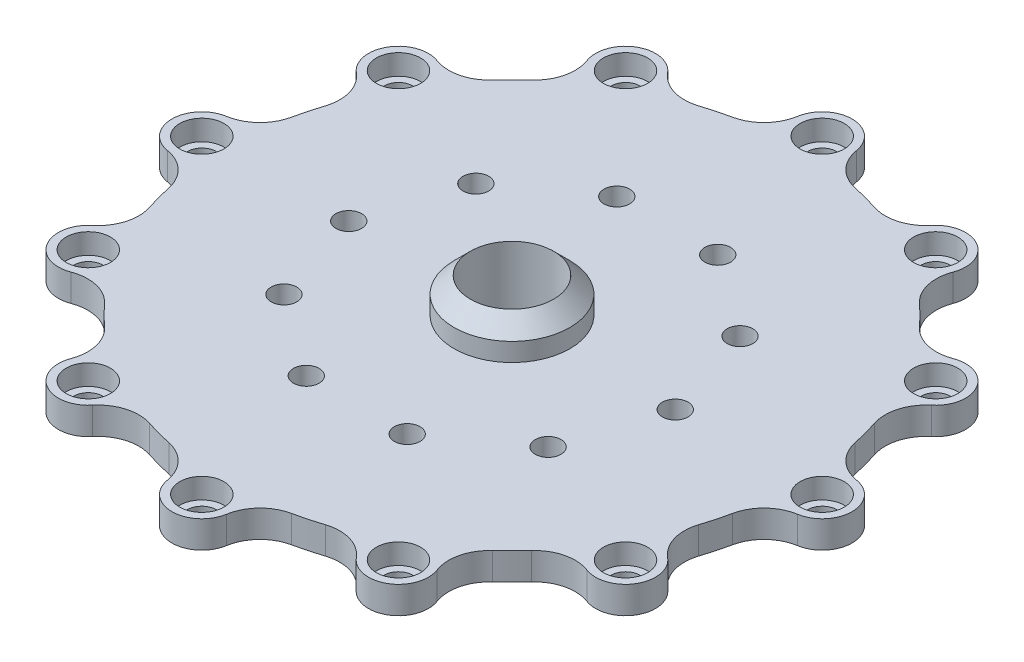
from build123d import *

# Parameters (mm, degrees)
CHAMFER1_SIZE                                    = 3.81
HOLE2_D                                          = 6
CIRPATTERN2_COUNT                                = 10
CBORE_FOR_1_4_SOCKET_SHOULDER_SCREW1_D           = 6.7564
CBORE_FOR_1_4_SOCKET_SHOULDER_SCREW1_CBORE_D     = 10.31748
CBORE_FOR_1_4_SOCKET_SHOULDER_SCREW1_CBORE_DEPTH = 4.7752
CIRPATTERN4_COUNT                                = 12
CUT_EXTRUDE3_REACH                               = 116.288
CIRPATTERN5_COUNT                                = 12


with BuildPart() as part:
    # Sketch1 → Revolve1 (revolve)
    with BuildSketch(Plane.XY):
        Polygon((79.375, 10.68578), (79.375, 17.03578), (13.52042, 17.03578), (13.52042, 25.13076), (9.71042, 25.13076), (9.71042, 0), (14.14526, -4.43484), (19.22526, -4.43484), (19.22526, 10.68578), align=None)
    revolve(axis=Axis((0, 0, 0), (0, 1, 0)))

    # Chamfer1
    chamfer1_edges = [part.edges().sort_by_distance(p)[0] for p in [
        (-13.52042, 25.13076, 0),
    ]]
    chamfer(chamfer1_edges, length=CHAMFER1_SIZE - 0.0001)  # a hair under: the kernel refuses the full size

    # Hole2 (through all)
    with Locations(Plane(origin=(0, 17.03578, 0), x_dir=(1, 0, 0), z_dir=(0, 1, 0))):
        with Locations((38.1, 0)):
            hole2 = Hole(HOLE2_D / 2)

    # CirPattern2: Hole2 ×10 about axis
    cirpattern2_axis = Axis((0, 0, 0), (0, 1, 0))
    for i in range(1, CIRPATTERN2_COUNT):
        add(hole2.rotate(cirpattern2_axis, i * 360 / CIRPATTERN2_COUNT), mode=Mode.SUBTRACT)

    # CBORE for 1/4 Socket Shoulder Screw1 (through all)
    with Locations(Plane(origin=(0, 17.03578, 0), x_dir=(1, 0, 0), z_dir=(0, 1, 0))):
        with Locations((72.39, 0)):
            cbore_for_1_4_socket_shoulder_screw1 = CounterBoreHole(CBORE_FOR_1_4_SOCKET_SHOULDER_SCREW1_D / 2, CBORE_FOR_1_4_SOCKET_SHOULDER_SCREW1_CBORE_D / 2, CBORE_FOR_1_4_SOCKET_SHOULDER_SCREW1_CBORE_DEPTH)

    # CirPattern4: CBORE for 1/4 Socket Shoulder Screw1 ×12 about axis
    cirpattern4_axis = Axis((0, 0, 0), (0, 1, 0))
    for i in range(1, CIRPATTERN4_COUNT):
        add(cbore_for_1_4_socket_shoulder_screw1.rotate(cirpattern4_axis, i * 360 / CIRPATTERN4_COUNT), mode=Mode.SUBTRACT)

    # Sketch17 → Cut-Extrude3 (cut, up to next)
    with BuildSketch(Plane(origin=(0, 17.03578, 0), x_dir=(1, 0, 0), z_dir=(0, 1, 0)), mode=Mode.PRIVATE) as cut_extrude3_sk1:
        with BuildLine():
            ThreePointArc((79.375, 0), (77.717548697, 4.517460557), (73.531778846, 6.891049707))
            ThreePointArc((73.531778846, 6.891049707), (68.521982999, 9.388428721), (65.780227273, 14.268770092))
            ThreePointArc((65.780227273, 14.268770092), (65.016467368, 17.421109926), (64.101732931, 20.532996256))
            ThreePointArc((64.101732931, 20.532996256), (64.035992356, 26.130373726), (67.12591332, 30.798065318))
            ThreePointArc((67.12591332, 30.798065318), (69.56410177, 34.946538746), (68.740766425, 39.6875))
            ThreePointArc((68.740766425, 39.6875), (76.670362462, 20.543761705), (79.375, 0))
        make_face()
    cut_extrude3_tool1 = extrude(cut_extrude3_sk1.sketch, amount=-CUT_EXTRUDE3_REACH, mode=Mode.PRIVATE) & part.part
    cut_extrude3 = cut_extrude3_tool1.solids().sort_by_distance((71.346501, 17.03578, -19.117237))[0]
    add(cut_extrude3, mode=Mode.SUBTRACT)

    # CirPattern5: Cut-Extrude3 ×12 about axis
    cirpattern5_axis = Axis((0, 0, 0), (0, 1, 0))
    for i in range(1, CIRPATTERN5_COUNT):
        add(cut_extrude3.rotate(cirpattern5_axis, i * 360 / CIRPATTERN5_COUNT), mode=Mode.SUBTRACT)


solid = part.part
